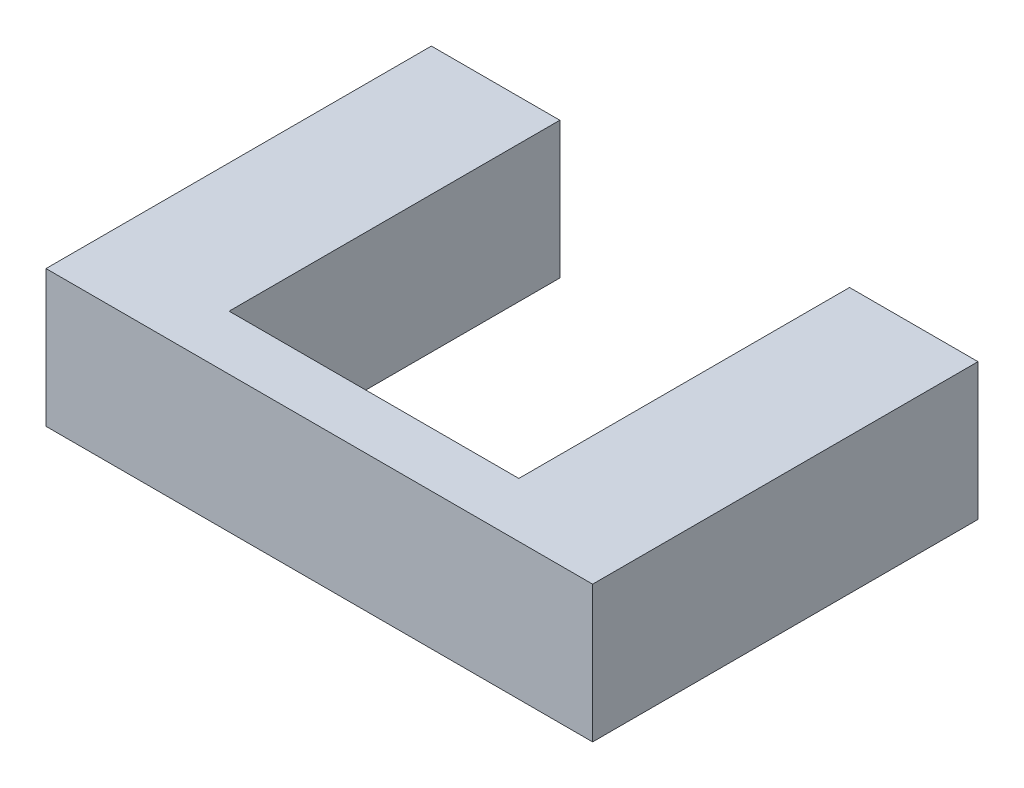
from build123d import *

# Parameters (mm, degrees)
SKETCH1_W           = 50.8
SKETCH1_H           = 35.814
BOSS_EXTRUDE1_DEPTH = 12.7
SKETCH2_W           = 26.924
SKETCH2_H           = 30.734
CUT_EXTRUDE1_DEPTH  = 12.7


with BuildPart() as part:
    # Sketch1 → Boss-Extrude1 (new body)
    with BuildSketch(Plane(origin=(0, 0, 0), x_dir=(1, 0, 0), z_dir=(0, 1, 0))):
        Rectangle(SKETCH1_W, SKETCH1_H)
    extrude(amount=BOSS_EXTRUDE1_DEPTH)

    # Sketch2 → Cut-Extrude1 (cut)
    with BuildSketch(Plane(origin=(0, 12.7, 0), x_dir=(1, 0, 0), z_dir=(0, 1, 0))):
        with Locations((0, 2.54)):
            Rectangle(SKETCH2_W, SKETCH2_H)
    extrude(amount=-CUT_EXTRUDE1_DEPTH, mode=Mode.SUBTRACT)


solid = part.part
